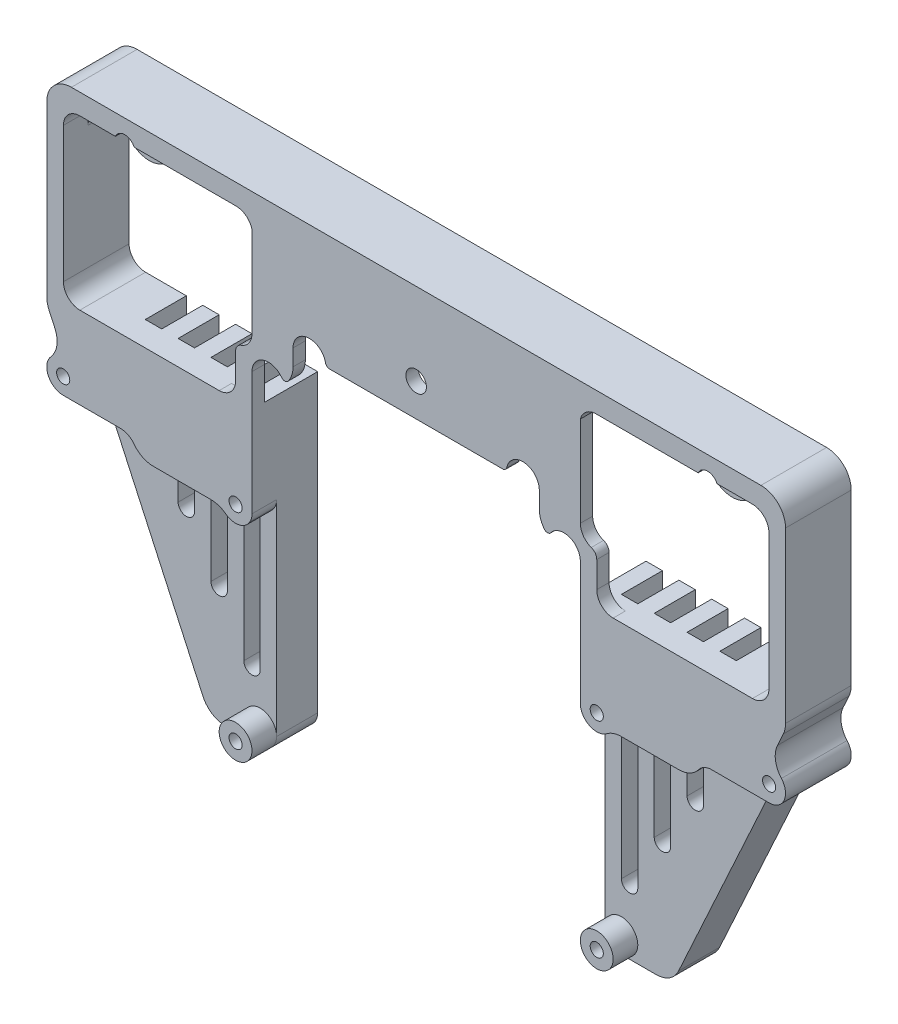
from build123d import *

# Parameters (mm, degrees)
EXTRUDE_1_DEPTH     = 5
SKETCH_3_R          = 2
EXTRUDE_2_DEPTH     = 5
FILLET_1_R          = 3
EXTRUDE_START       = 3
SKETCH_4_R          = 2
EXTRUDE_3_DEPTH     = 3
EXTRUDE_4_DEPTH     = 3
SKETCH_6_W          = 5
SKETCH_6_H          = 5
CUT_EXTRUDE_1_DEPTH = 3
EXTRUDE_5_DEPTH     = 3
CUT_EXTRUDE_2_DEPTH = 145.287907268
FILLET_2_R          = 2
SKETCH_9_W          = 22.970077348
SKETCH_9_H          = 3.5
CUT_EXTRUDE_3_DEPTH = 3
FILLET_3_R          = 2
FILLET_4_R          = 2
CUT_EXTRUDE_4_DEPTH = 5
HOLE_WIZARD_M2_1_D  = 1.6
EXTRUDE_START_2     = -8
EXTRUDE_6_DEPTH     = 8
FILLET_5_R          = 2
SKETCH_15_W         = 40
SKETCH_15_H         = 10
EXTRUDE_8_DEPTH     = 1.5
EXTRUDE_9_DEPTH     = 1.5
FILLET_7_R          = 2
FILLET_8_R          = 1
FILLET_9_R          = 2
SKETCH_17_R         = 2
CUT_EXTRUDE_5_DEPTH = 145.422990527
SKETCH_18_R         = 3
EXTRUDE_10_DEPTH    = 8
CUT_EXTRUDE_6_DEPTH = 3
FILLET_10_R         = 2
SKETCH_20_W         = 90
SKETCH_20_H         = 1
EXTRUDE_11_DEPTH    = 8
FILLET_11_R         = 3
HOLE_WIZARD_M3_1_D  = 2.5
HOLE_WIZARD_M3_2_D  = 2.5
FILLET_14_R         = 0.5


# Some blends are built 0.0001 mm under size
with BuildPart() as part:
    # ｽｹｯﾁ2 → ﾎﾞｽ - 押し出し1 (new body)
    with BuildSketch(Plane.XY):
        with BuildLine():
            Line((45, -77), (-45, -77))
            Line((-45, -77), (-45, -100.272382925))
            Line((-45, -100.272382925), (-28.166508533, -137.00000067))
            Line((-28.166508533, -137.00000067), (-22.000005394, -137.00000067))
            ThreePointArc((-22.000005394, -137.00000067), (-20.585788017, -136.414212653), (-20, -134.999995276))
            Line((-20, -134.999995276), (-20, -80))
            Line((-20, -80), (20, -80))
            Line((20, -80), (20, -135.006608121))
            ThreePointArc((20, -135.006608121), (20.588117326, -136.41654829), (21.999994577, -137))
            Line((21.999994577, -137), (28.166508841, -137))
            Line((28.166508841, -137), (45, -100.272382925))
            Line((45, -100.272382925), (45, -77))
        make_face()
    extrude(amount=EXTRUDE_1_DEPTH)

    # ｽｹｯﾁ3 → ﾎﾞｽ - 押し出し2 (add)
    with BuildSketch(Plane.XY.offset(5)):
        with Locations((-43, -107)):
            Circle(SKETCH_3_R)
        with Locations((43, -107)):
            Circle(SKETCH_3_R)
    extrude(amount=-EXTRUDE_2_DEPTH)

    # ﾌｨﾚｯﾄ1
    fillet_1_edges = [part.edges().sort_by_distance(p)[0] for p in [
        (-42.829852267, -105.007250706, 2.5),
        (-41.379356032, -108.171969764, 2.5),
        (41.379356032, -108.171969764, 2.5),
        (42.829852267, -105.007250706, 2.5),
    ]]
    fillet(fillet_1_edges, radius=FILLET_1_R)

    # ｽｹｯﾁ4 → ﾎﾞｽ - 押し出し3 (add)
    with BuildSketch(Plane.XY.offset(5).offset(EXTRUDE_START)):
        with Locations((-43, -107)):
            Circle(SKETCH_4_R)
        with Locations((-22, -110)):
            Circle(SKETCH_4_R)
        with Locations(Location((-22, -135, 0), (0, 0, 270))):
            Circle(SKETCH_4_R)
        with Locations(Location((22, -135, 0), (0, 0, 180))):
            Circle(SKETCH_4_R)
        with Locations(Location((22, -110, 0), (0, 0, 180))):
            Circle(SKETCH_4_R)
        with Locations((43, -107)):
            Circle(SKETCH_4_R)
    extrude(amount=-EXTRUDE_3_DEPTH)

    # ｽｹｯﾁ5 → ﾎﾞｽ - 押し出し4 (add)
    with BuildSketch(Plane.XY.offset(5)):
        Polygon((20, -98.999776146), (42.970077348, -98.999776146), (42.970077348, -108.999776146), (34, -108.999776146), (34, -110.999776146), (20, -110.999776146), (20, -108.999776146), align=None)
        Polygon((-34, -110.999776146), (-34, -108.999776146), (-42.970077348, -108.999776146), (-42.970077348, -98.999776146), (-20, -98.999776146), (-20, -108.999776146), (-20, -110.999776146), align=None)
    extrude(amount=EXTRUDE_4_DEPTH)

    # ｽｹｯﾁ6 → ｶｯﾄ - 押し出し1 (cut)
    with BuildSketch(Plane.XY.offset(8)):
        with Locations((40.470077348, -101.499776146)):
            Rectangle(SKETCH_6_W, SKETCH_6_H)
        with Locations((-40.470077348, -101.499776146)):
            Rectangle(SKETCH_6_W, SKETCH_6_H)
    extrude(amount=-CUT_EXTRUDE_1_DEPTH, mode=Mode.SUBTRACT)

    # ｽｹｯﾁ7 → ﾎﾞｽ - 押し出し5 (add)
    with BuildSketch(Plane.XY.offset(5).offset(EXTRUDE_START)):
        with BuildLine():
            Line((45, -100.272382925), (45, -77))
            Line((45, -77), (-45, -77))
            Line((-45, -77), (-45, -100.272382925))
            Line((-45, -100.272382925), (-44.011209399, -102.429744236))
            ThreePointArc((-44.011209399, -102.429744236), (-43.771304284, -104.122788565), (-44.495361547, -105.671883347))
            ThreePointArc((-44.495361547, -105.671883347), (-43.80601452, -105.169606438), (-42.970077348, -105.000223854))
            Line((-42.970077348, -105.000223854), (-42.970077348, -80))
            Line((-42.970077348, -80), (42.970077348, -80))
            Line((42.970077348, -80), (42.970077348, -105.000223854))
            ThreePointArc((42.970077348, -105.000223854), (43.80601452, -105.169606438), (44.495361547, -105.671883347))
            ThreePointArc((44.495361547, -105.671883347), (43.771304284, -104.122788565), (44.011209399, -102.429744236))
            Line((44.011209399, -102.429744236), (45, -100.272382925))
        make_face()
    extrude(amount=-EXTRUDE_5_DEPTH)

    # ｽｹｯﾁ8 → ｶｯﾄ - 押し出し2 (cut, through all)
    with BuildSketch(Plane.XY.offset(5)):
        Polygon((42.970077348, -103.999776146), (42.970077348, -80), (20, -80), (20, -98.999776146), (37.970077348, -98.999776146), (37.970077348, -103.999776146), align=None)
        Polygon((-20, -80), (-42.970077348, -80), (-42.970077348, -103.999776146), (-37.970077348, -103.999776146), (-37.970077348, -98.999776146), (-20, -98.999776146), align=None)
    extrude(amount=-CUT_EXTRUDE_2_DEPTH, mode=Mode.SUBTRACT)

    # ﾌｨﾚｯﾄ2
    fillet_2_edges = [part.edges().sort_by_distance(p)[0] for p in [
        (42.970077348, -103.999776146, 4),
        (37.970077348, -103.999776146, 4),
        (-37.970077348, -103.999776146, 4),
        (-42.970077348, -103.999776146, 4),
        (42.970077348, -80, 4),
        (-42.970077348, -80, 4),
    ]]
    fillet(fillet_2_edges, radius=FILLET_2_R)

    # ｽｹｯﾁ9 → ｶｯﾄ - 押し出し3 (cut)
    with BuildSketch(Plane.XY.offset(8)):
        with Locations((31.485038674, -80.25)):
            Rectangle(SKETCH_9_W, SKETCH_9_H)
        with Locations((-31.485038674, -80.25)):
            Rectangle(SKETCH_9_W, SKETCH_9_H)
    extrude(amount=-CUT_EXTRUDE_3_DEPTH, mode=Mode.SUBTRACT)

    # ﾌｨﾚｯﾄ3
    # the kernel refuses this fillet: 2 mm, written as the material it adds along each edge
    with BuildSketch(Plane(origin=(42.970077348, -78.5, 8), x_dir=(0, -1, 0), z_dir=(0, 0, -1)), Plane(origin=(-42.970077348, -78.5, 8), x_dir=(1, 0, 0), z_dir=(0, 0, -1))) as fillet_3_piece_1:
        with BuildLine():
            CenterArc((FILLET_3_R, FILLET_3_R), FILLET_3_R, 180, 90)
            Line((0, FILLET_3_R), (-FILLET_3_R * 0.02, FILLET_3_R))
            Line((-FILLET_3_R * 0.02, FILLET_3_R), (-FILLET_3_R * 0.02, -FILLET_3_R * 0.02))
            Line((-FILLET_3_R * 0.02, -FILLET_3_R * 0.02), (FILLET_3_R, -FILLET_3_R * 0.02))
            Line((FILLET_3_R, -FILLET_3_R * 0.02), (FILLET_3_R, 0))
        make_face()
    extrude(amount=8)
    with BuildSketch(Plane(origin=(20, -78.5, 8), x_dir=(0, -1, 0), z_dir=(0, 0, -1))) as fillet_3_piece_2:
        with BuildLine():
            CenterArc((2, -1.936491673), FILLET_3_R, 104.477512186, 75.522487814)
            Line((0, -1.936491673), (-0.04, -1.936491673))
            Line((-0.04, -1.936491673), (-0.04, 0))
            Line((-0.04, 0), (0, 0.04))
            ThreePointArc((0, 0.04), (0.75, 0.04), (1.49, 0.038729833))
            Line((1.49, 0.038729833), (1.5, 0))
        make_face()
    extrude(amount=7.841229183)
    with BuildSketch(Plane(origin=(-20, -78.5, 8), x_dir=(-1, 0, 0), z_dir=(0, 0, -1))) as fillet_3_piece_3:
        with BuildLine():
            CenterArc((1.936491673, -2), FILLET_3_R, 90, 75.522487814)
            Line((0, -1.5), (-0.038729833, -1.49))
            ThreePointArc((-0.038729833, -1.49), (-0.04, -0.75), (-0.04, 0))
            Line((-0.04, 0), (0, 0.04))
            Line((0, 0.04), (1.936491673, 0.04))
            Line((1.936491673, 0.04), (1.936491673, 0))
        make_face()
    extrude(amount=7.841229183)

    # ﾌｨﾚｯﾄ4
    # the kernel refuses this fillet: 2 mm, written as the material it adds along each edge
    with BuildSketch(Plane(origin=(34, -108.999776146, 0), x_dir=(1, 0, 0), z_dir=(0, 0, 1)), Plane(origin=(-34, -108.999776146, 0), x_dir=(0, -1, 0), z_dir=(0, 0, 1))) as fillet_4_piece_1:
        with BuildLine():
            CenterArc((FILLET_4_R, -FILLET_4_R), FILLET_4_R, 90, 90)
            Line((0, -FILLET_4_R), (0, 0))
            Line((0, 0), (FILLET_4_R, 0))
        make_face()
    extrude(amount=8)
    # the kernel refuses this fillet: 2 mm, written as the material it takes off along each edge
    with BuildSketch(Plane(origin=(-20, -110.999776146, 5), x_dir=(4.9216101662537e-12, 1.0, 0), z_dir=(0, 0, 1))) as fillet_4_2_piece_1:
        with BuildLine():
            CenterArc((0.999776146, 2), FILLET_4_R, 240.007404748, 29.992595252)
            Line((0, 0.26781997), (0, 0))
            Line((0, 0), (0.999776146, 0))
        make_face()
    extrude(amount=5.499440366, mode=Mode.SUBTRACT)
    with BuildSketch(Plane(origin=(20, -110.999776146, 5), x_dir=(1, 0, 0), z_dir=(0, 0, 1))) as fillet_4_2_piece_2:
        with BuildLine():
            CenterArc((2, 0.999776146), FILLET_4_R, 180, 29.992595251)
            Line((0, 0.999776146), (0, 0))
            Line((0, 0), (0.26781997, 0))
        make_face()
    extrude(amount=5.499440365, mode=Mode.SUBTRACT)

    # ｽｹｯﾁ10 → ｶｯﾄ - 押し出し4 (cut)
    with BuildSketch(Plane(origin=(0, 0, 0), x_dir=(-1, 0, 0), z_dir=(0, 0, -1))):
        with BuildLine():
            Line((-22, -98.999776146), (-22, -128.999776146))
            ThreePointArc((-22, -128.999776146), (-23, -129.999776146), (-24, -128.999776146))
            Line((-24, -128.999776146), (-24, -98.999776146))
            ThreePointArc((-24, -98.999776146), (-23, -97.999776146), (-22, -98.999776146))
        make_face()
        with BuildLine():
            Line((-26, -98.999776146), (-26, -122.635633085))
            ThreePointArc((-26, -122.635633085), (-27, -123.635633085), (-28, -122.635633085))
            Line((-28, -122.635633085), (-28, -98.999776146))
            ThreePointArc((-28, -98.999776146), (-27, -97.999776146), (-26, -98.999776146))
        make_face()
        with BuildLine():
            Line((-30, -98.999776146), (-30, -116.271490024))
            ThreePointArc((-30, -116.271490024), (-31, -117.271490024), (-32, -116.271490024))
            Line((-32, -116.271490024), (-32, -98.999776146))
            ThreePointArc((-32, -98.999776146), (-31, -97.999776146), (-30, -98.999776146))
        make_face()
        with BuildLine():
            Line((-34, -98.999776146), (-34, -109.907346962))
            ThreePointArc((-34, -109.907346962), (-35, -110.907346962), (-36, -109.907346962))
            Line((-36, -109.907346962), (-36, -98.999776146))
            ThreePointArc((-36, -98.999776146), (-35, -97.999776146), (-34, -98.999776146))
        make_face()
        with BuildLine():
            Line((22, -98.999776146), (22, -128.999776146))
            ThreePointArc((22, -128.999776146), (23, -129.999776146), (24, -128.999776146))
            Line((24, -128.999776146), (24, -98.999776146))
            ThreePointArc((24, -98.999776146), (23, -97.999776146), (22, -98.999776146))
        make_face()
        with BuildLine():
            Line((26, -98.999776146), (26, -122.635633085))
            ThreePointArc((26, -122.635633085), (27, -123.635633085), (28, -122.635633085))
            Line((28, -122.635633085), (28, -98.999776146))
            ThreePointArc((28, -98.999776146), (27, -97.999776146), (26, -98.999776146))
        make_face()
        with BuildLine():
            Line((30, -98.999776146), (30, -116.271490024))
            ThreePointArc((30, -116.271490024), (31, -117.271490024), (32, -116.271490024))
            Line((32, -116.271490024), (32, -98.999776146))
            ThreePointArc((32, -98.999776146), (31, -97.999776146), (30, -98.999776146))
        make_face()
        with BuildLine():
            Line((34, -98.999776146), (34, -109.907346962))
            ThreePointArc((34, -109.907346962), (35, -110.907346962), (36, -109.907346962))
            Line((36, -109.907346962), (36, -98.999776146))
            ThreePointArc((36, -98.999776146), (35, -97.999776146), (34, -98.999776146))
        make_face()
    extrude(amount=-CUT_EXTRUDE_4_DEPTH, mode=Mode.SUBTRACT)

    # M2 ねじ穴1 (through all)
    with Locations(Plane.XY.offset(8)):
        with Locations((43, -107), (22, -110), (21.999994577, -134.999994488), (-22, -110), (-22.000005394, -134.999995276), (-43, -107)):
            Hole(HOLE_WIZARD_M2_1_D / 2)

    # ｽｹｯﾁ14 → ﾎﾞｽ - 押し出し6 (add)
    with BuildSketch(Plane.XY.offset(8).offset(EXTRUDE_START_2)):
        with BuildLine():
            Line((-42.970077348, -101.999776146), (-42.970077348, -98.999776146))
            Line((-42.970077348, -98.999776146), (-37.970077348, -98.999776146))
            Line((-37.970077348, -98.999776146), (-37.970077348, -101.999776146))
            ThreePointArc((-37.970077348, -101.999776146), (-38.555863785, -103.413989709), (-39.970077348, -103.999776146))
            Line((-39.970077348, -103.999776146), (-40.970077348, -103.999776146))
            ThreePointArc((-40.970077348, -103.999776146), (-42.38429091, -103.413989709), (-42.970077348, -101.999776146))
        make_face()
        with BuildLine():
            Line((42.970077348, -98.999776146), (42.970077348, -101.999776146))
            ThreePointArc((42.970077348, -101.999776146), (42.38429091, -103.413989709), (40.970077348, -103.999776146))
            Line((40.970077348, -103.999776146), (39.970077348, -103.999776146))
            ThreePointArc((39.970077348, -103.999776146), (38.555863785, -103.413989709), (37.970077348, -101.999776146))
            Line((37.970077348, -101.999776146), (37.970077348, -98.999776146))
            Line((37.970077348, -98.999776146), (42.970077348, -98.999776146))
        make_face()
    extrude(amount=EXTRUDE_6_DEPTH)

    # ﾌｨﾚｯﾄ5
    fillet_5_edges = [part.edges().sort_by_distance(p)[0] for p in [
        (-42.970077348, -98.999776146, 4),
        (42.970077348, -98.999776146, 4),
    ]]
    fillet(fillet_5_edges, radius=FILLET_5_R)

    # ｽｹｯﾁ15 → ﾎﾞｽ - 押し出し8 (add)
    with BuildSketch(Plane.XY.offset(8)):
        with Locations((0, -85)):
            Rectangle(SKETCH_15_W, SKETCH_15_H)
    extrude(amount=-EXTRUDE_8_DEPTH)

    # ｽｹｯﾁ16 → ﾎﾞｽ - 押し出し9 (add)
    with BuildSketch(Plane.XY.offset(8)):
        with BuildLine():
            Line((20, -98.999776146), (20, -95))
            Line((20, -95), (18, -95))
            ThreePointArc((18, -95), (15.878679656, -94.121320344), (15, -92))
            Line((15, -92), (15, -90))
            Line((15, -90), (20, -90))
            Line((20, -90), (20, -93))
            Line((20, -93), (22, -93))
            Line((22, -93), (22, -98.999776146))
            Line((22, -98.999776146), (20, -98.999776146))
        make_face()
    extrude_9 = extrude(amount=-EXTRUDE_9_DEPTH)

    # ﾐﾗｰ1: ﾎﾞｽ - 押し出し9 across plane
    add(extrude_9.mirror(Plane(origin=(0, 0, 0), x_dir=(0, 0, 1), z_dir=(1, 0, 0))))

    # ﾌｨﾚｯﾄ7
    fillet_7_edges = [part.edges().sort_by_distance(p)[0] for p in [
        (-20, -93, 7.25),
        (20, -93, 7.25),
    ]]
    fillet(fillet_7_edges, radius=FILLET_7_R - 0.0001)  # a hair under: the kernel refuses the full size

    # ﾌｨﾚｯﾄ8
    fillet_8_edges = [part.edges().sort_by_distance(p)[0] for p in [
        (22, -93, 7.25),
        (-22, -93, 7.25),
    ]]
    fillet(fillet_8_edges, radius=FILLET_8_R)

    # ﾌｨﾚｯﾄ9
    fillet_9_edges = [part.edges().sort_by_distance(p)[0] for p in [
        (22, -98.999776146, 7.25),
        (-22, -98.999776146, 7.25),
    ]]
    fillet(fillet_9_edges, radius=FILLET_9_R)

    # ｽｹｯﾁ17 → ｶｯﾄ - 押し出し5 (cut, through all)
    with BuildSketch(Plane.XY.offset(8)):
        with Locations((-18, -95)):
            Circle(SKETCH_17_R)
        with Locations((-13, -90)):
            Circle(SKETCH_17_R)
        with Locations((13, -90)):
            Circle(SKETCH_17_R)
        with Locations((18, -95)):
            Circle(SKETCH_17_R)
    extrude(amount=-CUT_EXTRUDE_5_DEPTH, mode=Mode.SUBTRACT)

    # ｽｹｯﾁ18 → ﾎﾞｽ - 押し出し10 (add)
    with BuildSketch(Plane.XY.offset(8).offset(EXTRUDE_START_2)):
        with Locations((35.5, -79)):
            Circle(SKETCH_18_R)
        with Locations((-35.5, -79)):
            Circle(SKETCH_18_R)
    extrude(amount=EXTRUDE_10_DEPTH)

    # ｽｹｯﾁ19 → ｶｯﾄ - 押し出し6 (cut)
    with BuildSketch(Plane.XY.offset(5)):
        with BuildLine():
            Line((38.458039892, -78.5), (32.541960108, -78.5))
            ThreePointArc((32.541960108, -78.5), (35.5, -82), (38.458039892, -78.5))
        make_face()
        with BuildLine():
            Line((-38.458039892, -78.5), (-32.541960108, -78.5))
            ThreePointArc((-32.541960108, -78.5), (-35.5, -82), (-38.458039892, -78.5))
        make_face()
    extrude(amount=CUT_EXTRUDE_6_DEPTH, mode=Mode.SUBTRACT)

    # ﾌｨﾚｯﾄ10
    fillet_10_edges = [part.edges().sort_by_distance(p)[0] for p in [
        (38.328427125, -80, 2.5),
        (32.671572875, -80, 2.5),
        (-32.671572875, -80, 2.5),
        (-38.328427125, -80, 2.5),
    ]]
    fillet(fillet_10_edges, radius=FILLET_10_R)

    # ｽｹｯﾁ20 → ﾎﾞｽ - 押し出し11 (add)
    with BuildSketch(Plane.XY.offset(8)):
        with Locations((0, -76.5)):
            Rectangle(SKETCH_20_W, SKETCH_20_H)
    extrude(amount=-EXTRUDE_11_DEPTH)

    # ﾌｨﾚｯﾄ11
    # the kernel refuses this fillet: 3 mm, written as the material it adds along each edge
    with BuildSketch(Plane(origin=(23.73218003, -110.999776146, 5), x_dir=(1, 0, 0), z_dir=(0, 0, 1))) as fillet_11_piece_1:
        with BuildLine():
            CenterArc((1.268118418, -3), FILLET_11_R, 90, 36.874172726)
            ThreePointArc((-0.532060651, -0.600134312), (-0.235638933, -0.327011231), (0, 0))
            Line((0, 0), (1.268118418, 0))
        make_face()
    extrude(amount=3)
    with BuildSketch(Plane(origin=(-23.73218003, -110.999776146, 5), x_dir=(0.6633936886760347, -0.7482705485483204, 0), z_dir=(0, 0, 1))) as fillet_11_piece_2:
        with BuildLine():
            CenterArc((1.403549891, -2.93907673), FILLET_11_R, 101.566616011, 36.874172726)
            Line((-0.841261755, -0.948895664), (0, 0))
            ThreePointArc((0, 0), (0.401014254, -0.040615513), (0.802028509, 0))
        make_face()
    extrude(amount=3)
    # the kernel refuses this fillet: 3 mm, written as the material it takes off along each edge
    with BuildSketch(Plane(origin=(45, -76, 15.5), x_dir=(-1, 0, 0), z_dir=(0, 0, -1)), Plane(origin=(-45, -76, 15.5), x_dir=(0, -1, 0), z_dir=(0, 0, -1))) as fillet_11_2_piece_1:
        with BuildLine():
            CenterArc((FILLET_11_R, -FILLET_11_R), FILLET_11_R, 90, 90)
            Line((0, -FILLET_11_R), (0, 0))
            Line((0, 0), (FILLET_11_R, 0))
        make_face()
    extrude(amount=23, mode=Mode.SUBTRACT)
    with BuildSketch(Plane(origin=(34, -110.999776146, 5), x_dir=(0.3162277660166172, 0.9486832980505874, 0), z_dir=(0, 0, 1))) as fillet_11_2_piece_2:
        with BuildLine():
            CenterArc((2.213594362, 2.846049894), FILLET_11_R, 198.434948823, 53.130102354)
            Line((-0.632455532, 1.897366596), (0, 0))
            ThreePointArc((0, 0), (0.632455532, 0.102633404), (1.264911064, 0))
        make_face()
    extrude(amount=8, mode=Mode.SUBTRACT)
    with BuildSketch(Plane(origin=(-34, -110.999776146, 5), x_dir=(1, 0, 0), z_dir=(0, 0, 1))) as fillet_11_2_piece_3:
        with BuildLine():
            CenterArc((2, 3), FILLET_11_R, 216.869897646, 53.130102354)
            ThreePointArc((-0.4, 1.2), (-0.102633404, 0.632455532), (0, 0))
            Line((0, 0), (2, 0))
        make_face()
    extrude(amount=8, mode=Mode.SUBTRACT)
    with BuildSketch(Plane(origin=(45, -100.272382925, -1.636880158), x_dir=(0, 1, 0), z_dir=(0, 0, 1)), Plane(origin=(-45, -100.272382925, -1.636880158), x_dir=(0.41665471049321134, -0.9090648228942853, 0), z_dir=(0, 0, 1))) as fillet_11_2_piece_4:
        with BuildLine():
            CenterArc((FILLET_11_R * 0.218250687717, FILLET_11_R), FILLET_11_R, 245.376435214, 24.623564786)
            Line((-FILLET_11_R * 0.198404022776, FILLET_11_R * 0.0909351771057), (0, 0))
            Line((0, 0), (FILLET_11_R * 0.218250687717, 0))
        make_face()
    extrude(amount=11.273760316, mode=Mode.SUBTRACT)
    with BuildSketch(Plane(origin=(28.166508841, -137, -4.812736739), x_dir=(-1, 0, 0), z_dir=(0, 0, 1)), Plane(origin=(-28.166508533, -137.00000067, -4.812736739), x_dir=(-0.4166547104932151, 0.9090648228942835, 0), z_dir=(0, 0, 1))) as fillet_11_2_piece_5:
        with BuildLine():
            CenterArc((FILLET_11_R * 0.64169823187, -FILLET_11_R), FILLET_11_R, 90, 65.376435214)
            Line((-FILLET_11_R * 0.267366591024, -FILLET_11_R * 0.583345289506), (0, 0))
            Line((0, 0), (FILLET_11_R * 0.64169823187, 0))
        make_face()
    extrude(amount=14.625473478, mode=Mode.SUBTRACT)

    # M3 ねじ穴1 (through all)
    with Locations(Plane.XY.offset(8)):
        with Locations((0, -86)):
            Hole(HOLE_WIZARD_M3_1_D / 2)

    # M3 ねじ穴2 (through all)
    with Locations(Plane(origin=(0, 0, 0), x_dir=(-1, 0, 0), z_dir=(0, 0, -1))):
        with Locations((-35.5, -79), (35.5, -79)):
            Hole(HOLE_WIZARD_M3_2_D / 2)

    # ﾌｨﾚｯﾄ14
    fillet_14_edges = [part.edges().sort_by_distance(p)[0] for p in [
        (-16.114381917, -94.333333333, 7.25),
        (-11, -90, 7.25),
        (11, -90, 7.25),
        (16.114381917, -94.333333333, 7.25),
    ]]
    fillet(fillet_14_edges, radius=FILLET_14_R)


solid = part.part
